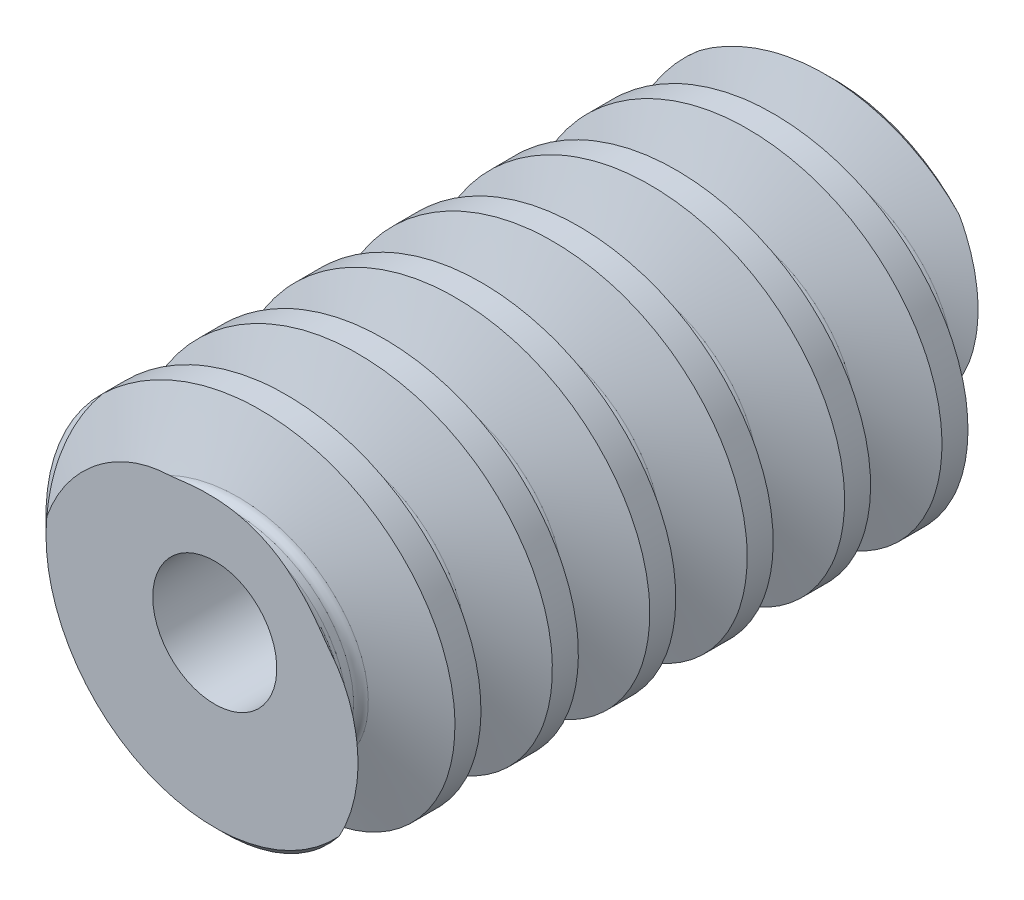
from build123d import *

# Parameters (mm, degrees)
SWEEP_01_PITCH = 1.570796303
SKETCH6_R      = 1
EXTRUDE1_DEPTH = 10


with BuildPart() as part:
    # Sketch 01 → 蜗杆01 (revolve)
    with BuildSketch(Plane(origin=(0, 0, 0), x_dir=(0, 0, -1), z_dir=(1, 0, 0)), mode=Mode.PRIVATE) as revolve_01_sk:
        Polygon((5, 0), (5, 2.722), (4.722, 3), (-4.722, 3), (-5, 2.722), (-5, 0), align=None)
    revolve(revolve_01_sk.sketch.rotate(Axis((0, 0, 0), (0, 0, -1)), 90), axis=Axis((0, 0, 0), (0, 0, -1)))

    # 齿切除蜗杆01: the profile of Sketch 01 2 screwed along a right-hand helix of 8 turns, 8 arcs to a turn; built about Z, then put on its axis
    sweep_01_z = Axis((0, 0, 0), (0, 0, 1))
    sweep_01_corners = [(3.124999998, 0, 0.621413516), (1.973451673, 0, 0.200012341), (1.875000017, 0, 0.059147981), (1.875000017, 0, -0.059147981), (1.973451673, 0, -0.200012341), (3.124999998, 0, -0.621413516)]
    with BuildLine(mode=Mode.PRIVATE) as sweep_01_profile:
        Line(sweep_01_corners[0], sweep_01_corners[1])
        Line(sweep_01_corners[2], sweep_01_corners[3])
        Line(sweep_01_corners[4], sweep_01_corners[5])
        Line(sweep_01_corners[5], sweep_01_corners[0])
        ThreePointArc((1.973451673, 0, 0.200012341), (1.902052362, 0, 0.145077453), (1.875000017, 0, 0.059147981))
        ThreePointArc((1.875000017, 0, -0.059147981), (1.902052362, 0, -0.145077453), (1.973451673, 0, -0.200012341))
    sweep_01_cap = Face(sweep_01_profile.wire())
    sweep_01_arcs = [((1.973451673, 0, 0.200012341), (1.875000017, 0, 0.163984635), (1.875000017, 0, 0.059147981), (1, 0.8196510285824665, 1)), ((1.875000017, 0, -0.059147981), (1.875000017, 0, -0.163984635), (1.973451673, 0, -0.200012341), (1, 0.8196510285824732, 1))]  # start, shoulder, end, weights
    sweep_01_turn_angles = [0, 22.5, 45, 67.5, 90, 112.5, 135, 157.5, 180, 202.5, 225, 247.5, 270, 292.5, 315, 337.5, 360]
    sweep_01_turn_weights = [1, 0.9238795325112867, 1, 0.9238795325112867, 1, 0.9238795325112867, 1, 0.9238795325112867, 1, 0.9238795325112867, 1, 0.9238795325112867, 1, 0.9238795325112867, 1, 0.9238795325112867, 1]
    sweep_01_turn_rails = [Edge.make_bspline([Vector(p[0], p[1], 0).rotate(sweep_01_z, sweep_01_turn_angles[k]) / sweep_01_turn_weights[k] + Vector(0, 0, p[2] + SWEEP_01_PITCH * sweep_01_turn_angles[k] / 360) for k in range(17)], [0, 0, 0, 1, 1, 2, 2, 3, 3, 4, 4, 5, 5, 6, 6, 7, 7, 8, 8, 8], 2, sweep_01_turn_weights) for p in sweep_01_corners]
    sweep_01_turn_sides = [*[Face.make_surface_from_curves(sweep_01_turn_rails[p[0]], sweep_01_turn_rails[p[1]]) for p in [(0, 1), (2, 3), (4, 5), (5, 0)]], *[Face.make_bezier_surface([[Vector(p[j][0], p[j][1], 0).rotate(sweep_01_z, sweep_01_turn_angles[2 * i + k]) / sweep_01_turn_weights[2 * i + k] + Vector(0, 0, p[j][2] + SWEEP_01_PITCH * sweep_01_turn_angles[2 * i + k] / 360) for k in range(3)] for j in range(3)], [[p[3][j] * sweep_01_turn_weights[2 * i + k] for k in range(3)] for j in range(3)]) for p in sweep_01_arcs for i in range(8)]]
    sweep_01 = Plane(origin=(0, 0, 6.283185213), x_dir=(1, 0, 0), z_dir=(0, 0, -1)) * Solid(Shell([*[p.moved(Location((0, 0, SWEEP_01_PITCH * i))) for i in range(8) for p in sweep_01_turn_sides], sweep_01_cap, sweep_01_cap.rotate(sweep_01_z, 2880).moved(Location((0, 0, SWEEP_01_PITCH * 2880 / 360)))]))
    add(sweep_01, mode=Mode.SUBTRACT)

    # Sketch6 → Extrude1 (cut)
    with BuildSketch(Plane(origin=(0, 0, -5), x_dir=(-1, 0, 0), z_dir=(0, 0, -1))):
        Circle(SKETCH6_R)
    extrude(amount=-EXTRUDE1_DEPTH, mode=Mode.SUBTRACT)


solid = part.part
